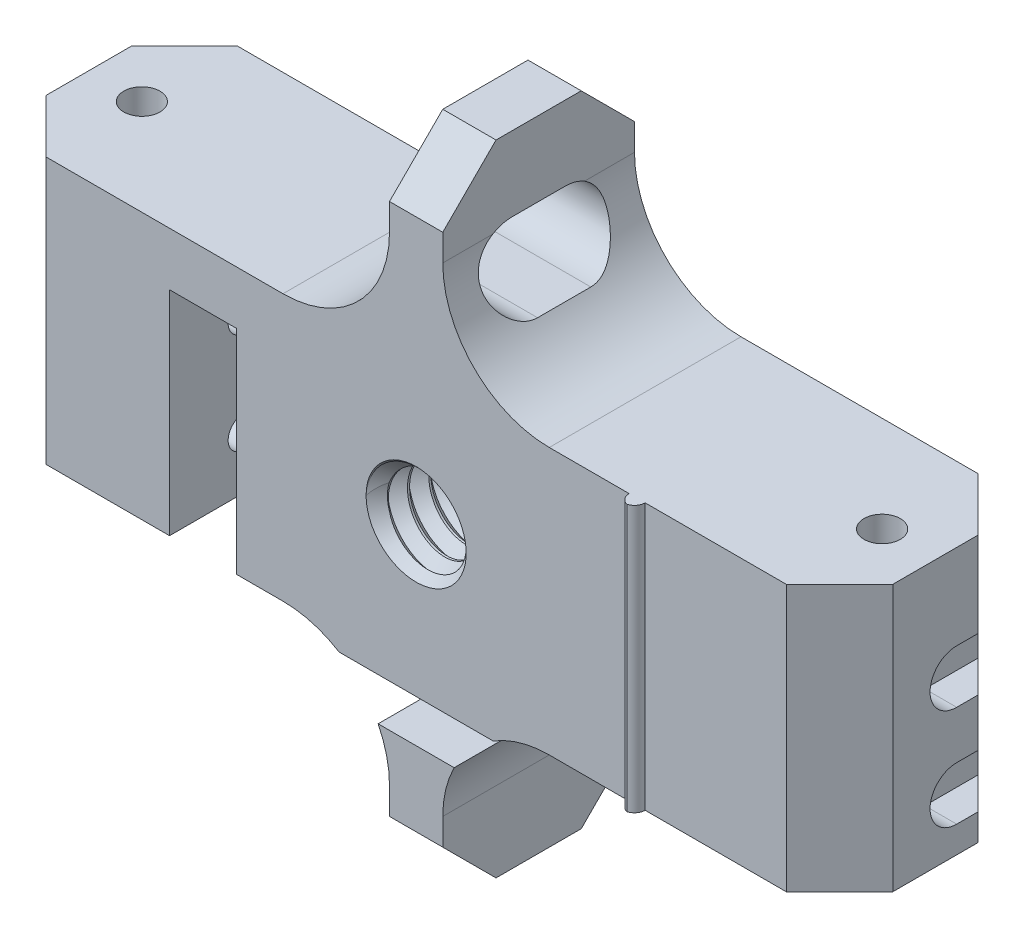
from build123d import *
from build123d.topology import SkipClean

# Parameters (mm, degrees)
Y_KSEKLIK_EKSTR_ZYON1_DEPTH = 18
PAH1_SIZE                   = 5
PAH2_SIZE                   = 5
PAH3_SIZE                   = 5
KES_EKSTR_ZYON1_DEPTH       = 18
KES_EKSTR_ZYON1_DEPTH_BACK  = 18
IZIM3_W                     = 6.3
IZIM3_H                     = 20
KES_EKSTR_ZYON2_DEPTH       = 15.5
IZIM4_W                     = 6.3
IZIM4_H                     = 20
KES_EKSTR_ZYON3_DEPTH       = 15.5
IZIM5_R                     = 1.5
KES_EKSTR_ZYON4_DEPTH       = 28
IZIM6_R                     = 1.5
KES_EKSTR_ZYON6_DEPTH       = 28
IZIM7_R                     = 1.7
KES_EKSTR_ZYON13_DEPTH      = 28
IZIM8_R                     = 1.7
KES_EKSTR_ZYON14_DEPTH      = 28
KES_EKSTR_ZYON15_DEPTH      = 3
KES_EKSTR_ZYON16_DEPTH      = 3
IZIM11_R                    = 3.7
KES_EKSTR_ZYON17_DEPTH      = 20
IZIM13_W                    = 1.5
IZIM13_H                    = 25
Y_KSEKLIK_EKSTR_ZYON2_DEPTH = 1
RADYUS1_R                   = 1
KES_EKSTR_ZYON19_DEPTH      = 52
PAH4_SIZE                   = 1
KES_S_P_R3_PITCH            = 2


with BuildPart() as part:
    # Çizim1 → Yükseklik-Ekstrüzyon1 (new body)
    with BuildSketch(Plane.XY):
        with BuildLine():
            Line((0, 0), (27.25, 0))
            ThreePointArc((27.25, 0), (34.321067812, -2.928932188), (37.25, -10))
            Line((37.25, -10), (37.25, -17.5))
            Line((37.25, -17.5), (42.25, -17.5))
            Line((42.25, -17.5), (42.25, -10))
            ThreePointArc((42.25, -10), (45.178932188, -2.928932188), (52.25, 0))
            Line((52.25, 0), (79.5, 0))
            Line((79.5, 0), (79.5, 25))
            Line((79.5, 25), (52.25, 25))
            ThreePointArc((52.25, 25), (45.178932188, 27.928932188), (42.25, 35))
            Line((42.25, 35), (42.25, 42.5))
            Line((42.25, 42.5), (37.25, 42.5))
            Line((37.25, 42.5), (37.25, 35))
            ThreePointArc((37.25, 35), (34.321067812, 27.928932188), (27.25, 25))
            Line((27.25, 25), (0, 25))
            Line((0, 25), (0, 0))
        make_face()
    extrude(amount=Y_KSEKLIK_EKSTR_ZYON1_DEPTH)

    # Pah1
    pah1_edges = [part.edges().sort_by_distance(p)[0] for p in [
        (79.5, 12.5, 0),
        (79.5, 12.5, 18),
    ]]
    chamfer(pah1_edges, length=PAH1_SIZE)

    # Pah2
    pah2_edges = [part.edges().sort_by_distance(p)[0] for p in [
        (0, 12.5, 0),
        (0, 12.5, 18),
    ]]
    chamfer(pah2_edges, length=PAH2_SIZE)

    # Pah3
    pah3_edges = [part.edges().sort_by_distance(p)[0] for p in [
        (39.75, 42.5, 0),
        (39.75, -17.5, 18),
        (39.75, -17.5, 0),
        (39.75, 42.5, 18),
    ]]
    chamfer(pah3_edges, length=PAH3_SIZE)

    # Çizim2 → Kes-Ekstrüzyon1 (cut, two sides: drawn at the far end of the back side and taken through both)
    with BuildSketch(Plane(origin=(42.25, 0, 0), x_dir=(0, 0, -1), z_dir=(1, 0, 0)).offset(-KES_EKSTR_ZYON1_DEPTH_BACK)):
        with BuildLine():
            Line((-12, -5.5), (-20.653950413, -5.5))
            Line((-20.653950413, -5.5), (-20.653950413, -1.5))
            Line((-20.653950413, -1.5), (-12, -1.5))
            ThreePointArc((-12, -1.5), (-10, -3.5), (-12, -5.5))
        make_face()
    extrude(amount=KES_EKSTR_ZYON1_DEPTH + KES_EKSTR_ZYON1_DEPTH_BACK, mode=Mode.SUBTRACT)

    # Çizim3 → Kes-Ekstrüzyon2 (cut)
    with BuildSketch(Plane.XY.offset(18)):
        with Locations((19.75, 10)):
            Rectangle(IZIM3_W, IZIM3_H)
    extrude(amount=-KES_EKSTR_ZYON2_DEPTH, mode=Mode.SUBTRACT)

    # Çizim4 → Kes-Ekstrüzyon3 (cut)
    with BuildSketch(Plane(origin=(0, 0, 0), x_dir=(-1, 0, 0), z_dir=(0, 0, -1))):
        with Locations((-59.75, 10)):
            Rectangle(IZIM4_W, IZIM4_H)
    extrude(amount=-KES_EKSTR_ZYON3_DEPTH, mode=Mode.SUBTRACT)

    # Çizim5 → Kes-Ekstrüzyon4 (cut)
    with BuildSketch(Plane.ZY):
        with Locations((11, 5)):
            Circle(IZIM5_R)
        with Locations((11, 14.5)):
            Circle(IZIM5_R)
    extrude(amount=-KES_EKSTR_ZYON4_DEPTH, mode=Mode.SUBTRACT)

    # Çizim6 → Kes-Ekstrüzyon6 (cut)
    with BuildSketch(Plane(origin=(79.5, 0, 0), x_dir=(0, 0, -1), z_dir=(1, 0, 0))):
        with Locations((-7, 5)):
            Circle(IZIM6_R)
        with Locations((-7, 14.5)):
            Circle(IZIM6_R)
    extrude(amount=-KES_EKSTR_ZYON6_DEPTH, mode=Mode.SUBTRACT)

    # Çizim7 → Kes-Ekstrüzyon13 (cut)
    with BuildSketch(Plane.XZ):
        with Locations(Location((5, 9, 0), (0, 0, 270))):
            Circle(IZIM7_R)
    extrude(amount=-KES_EKSTR_ZYON13_DEPTH, mode=Mode.SUBTRACT)

    # Çizim8 → Kes-Ekstrüzyon14 (cut)
    with BuildSketch(Plane.XZ):
        with Locations(Location((74.5, 9, 0), (0, 0, 270))):
            Circle(IZIM8_R)
    extrude(amount=-KES_EKSTR_ZYON14_DEPTH, mode=Mode.SUBTRACT)

    # Çizim9 → Kes-Ekstrüzyon15 (cut)
    with BuildSketch(Plane.ZY):
        with BuildLine():
            Line((11, 17), (21, 17))
            Line((21, 17), (21, 12))
            Line((21, 12), (11, 12))
            ThreePointArc((11, 12), (8.5, 14.5), (11, 17))
        make_face()
        with BuildLine():
            Line((11, 7.5), (21, 7.5))
            Line((21, 7.5), (21, 2.5))
            Line((21, 2.5), (11, 2.5))
            ThreePointArc((11, 2.5), (8.5, 5), (11, 7.5))
        make_face()
    extrude(amount=-KES_EKSTR_ZYON15_DEPTH, mode=Mode.SUBTRACT)

    # Çizim10 → Kes-Ekstrüzyon16 (cut)
    with BuildSketch(Plane(origin=(79.5, 0, 0), x_dir=(0, 0, -1), z_dir=(1, 0, 0))):
        with BuildLine():
            Line((-7, 2.5), (3, 2.5))
            Line((3, 2.5), (3, 7.5))
            Line((3, 7.5), (-7, 7.5))
            ThreePointArc((-7, 7.5), (-9.5, 5), (-7, 2.5))
        make_face()
        with BuildLine():
            Line((-7, 12), (3, 12))
            Line((3, 12), (3, 17))
            Line((3, 17), (-7, 17))
            ThreePointArc((-7, 17), (-9.5, 14.5), (-7, 12))
        make_face()
    extrude(amount=-KES_EKSTR_ZYON16_DEPTH, mode=Mode.SUBTRACT)

    # Çizim11 → Kes-Ekstrüzyon17 (cut)
    with BuildSketch(Plane.XY.offset(18)):
        with Locations((39.75, 12.5)):
            Circle(IZIM11_R)
    extrude(amount=-KES_EKSTR_ZYON17_DEPTH, mode=Mode.SUBTRACT)

    # Çizim13 → Yükseklik-Ekstrüzyon2 (add)
    with BuildSketch(Plane.XY.offset(18)):
        with Locations((60.5, 12.5)):
            Rectangle(IZIM13_W, IZIM13_H)
    extrude(amount=Y_KSEKLIK_EKSTR_ZYON2_DEPTH)

    # Radyus1
    # the kernel refuses this fillet: 1 mm, written as the material it takes off along each edge
    with BuildSketch(Plane(origin=(59.75, -2.5, 19), x_dir=(0, 0, -1), z_dir=(0, 1, 0)), Plane(origin=(61.25, 27.5, 19), x_dir=(0, 0, -1), z_dir=(0, -1, 0))) as radyus1_piece_1:
        with BuildLine():
            CenterArc((RADYUS1_R, -RADYUS1_R), RADYUS1_R, 90, 90)
            Line((0, -RADYUS1_R), (0, 0))
            Line((0, 0), (RADYUS1_R, 0))
        make_face()
    extrude(amount=30, mode=Mode.SUBTRACT)

    # Çizim15 → Kes-Ekstrüzyon19 (cut)
    with BuildSketch(Plane.ZY):
        with BuildLine():
            Line((11.5, 28.5), (6.5, 28.5))
            ThreePointArc((6.5, 28.5), (3, 32), (6.5, 35.5))
            Line((6.5, 35.5), (11.5, 35.5))
            ThreePointArc((11.5, 35.5), (15, 32), (11.5, 28.5))
        make_face()
    extrude(amount=-KES_EKSTR_ZYON19_DEPTH, mode=Mode.SUBTRACT)

    # Pah4
    pah4_edges = [part.edges().sort_by_distance(p)[0] for p in [
        (36.05, 12.5, 0),
        (36.05, 12.5, 18),
    ]]
    chamfer(pah4_edges, length=PAH4_SIZE)

    # Kes-Süpür3: the profile of Çizim19 profile screwed along a right-hand helix of 10 turns, 10 arcs to a turn; built about Z, then put on its axis
    with SkipClean():  # the faces are left unmerged after this step: merging them gives an invalid solid
        kes_s_p_r3_z = Axis((0, 0, 0), (0, 0, 1))
        kes_s_p_r3_corners = [(3.6997, 0, 0.90027), (3.6997, 0, -0.90027), (4.7, 0, 0)]
        with BuildLine(mode=Mode.PRIVATE) as kes_s_p_r3_profile:
            Line(kes_s_p_r3_corners[0], kes_s_p_r3_corners[1])
            Line(kes_s_p_r3_corners[1], kes_s_p_r3_corners[2])
            Line(kes_s_p_r3_corners[2], kes_s_p_r3_corners[0])
        kes_s_p_r3_cap = Face(kes_s_p_r3_profile.wire())
        kes_s_p_r3_turn_angles = [0, 18, 36, 54, 72, 90, 108, 126, 144, 162, 180, 198, 216, 234, 252, 270, 288, 306, 324, 342, 360]
        kes_s_p_r3_turn_weights = [1, 0.9510565162951535, 1, 0.9510565162951535, 1, 0.9510565162951535, 1, 0.9510565162951535, 1, 0.9510565162951535, 1, 0.9510565162951535, 1, 0.9510565162951535, 1, 0.9510565162951535, 1, 0.9510565162951535, 1, 0.9510565162951535, 1]
        kes_s_p_r3_turn_rails = [Edge.make_bspline([Vector(p[0], p[1], 0).rotate(kes_s_p_r3_z, kes_s_p_r3_turn_angles[k]) / kes_s_p_r3_turn_weights[k] + Vector(0, 0, p[2] + KES_S_P_R3_PITCH * kes_s_p_r3_turn_angles[k] / 360) for k in range(21)], [0, 0, 0, 1, 1, 2, 2, 3, 3, 4, 4, 5, 5, 6, 6, 7, 7, 8, 8, 9, 9, 10, 10, 10], 2, kes_s_p_r3_turn_weights) for p in kes_s_p_r3_corners]
        kes_s_p_r3_turn_sides = [Face.make_surface_from_curves(kes_s_p_r3_turn_rails[p[0]], kes_s_p_r3_turn_rails[p[1]]) for p in [(0, 1), (1, 2), (2, 0)]]
        kes_s_p_r3 = Plane(origin=(39.75, 12.5, 18), x_dir=(-1, 0, 0), z_dir=(0, 0, -1)) * Solid(Shell([*[p.moved(Location((0, 0, KES_S_P_R3_PITCH * i))) for i in range(10) for p in kes_s_p_r3_turn_sides], kes_s_p_r3_cap, kes_s_p_r3_cap.rotate(kes_s_p_r3_z, 3600).moved(Location((0, 0, KES_S_P_R3_PITCH * 3600 / 360)))]))
        add(kes_s_p_r3, mode=Mode.SUBTRACT)


solid = part.part
